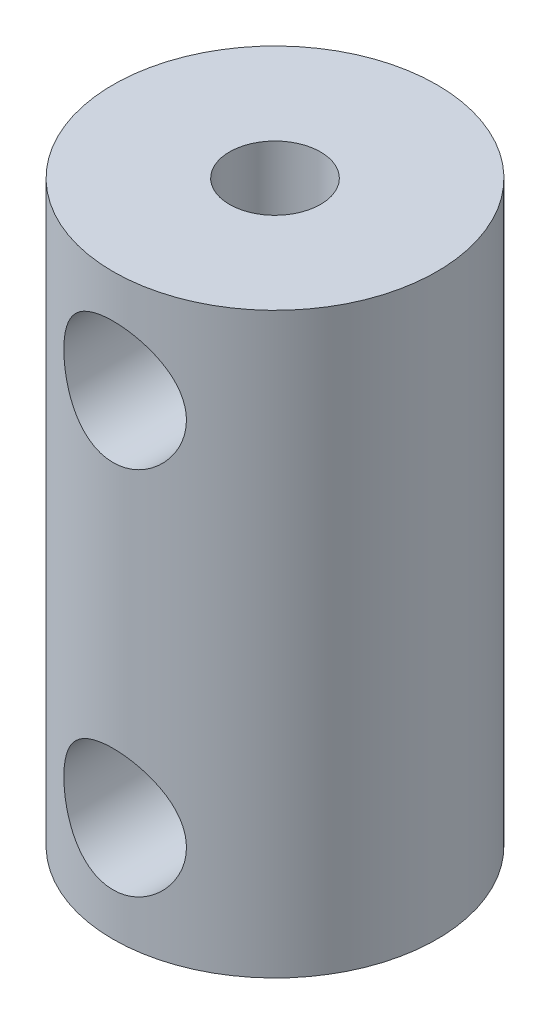
from build123d import *

# Parameters (mm, degrees)
SKETCH1_R                       = 5.334
BOSS_EXTRUDE1_DEPTH             = 19.05
F_3_0MM_DOWEL_HOLE3_D           = 3
F_3_0MM_DOWEL_HOLE3_DEPTH       = 9.525
F_3_0MM_DOWEL_HOLE3_TIP         = 0.901290929
F_3_16_0_1875_DOWEL_HOLE1_D     = 4.7625
F_3_16_0_1875_DOWEL_HOLE1_DEPTH = 9.525
F_3_16_0_1875_DOWEL_HOLE1_TIP   = 1.430799349
F_10_32_TAPPED_HOLE1_OUTLINE_R  = 2.0193
F_10_32_TAPPED_HOLE1_DEPTH      = 6


with BuildPart() as part:
    # Sketch1 → Boss-Extrude1 (new body)
    with BuildSketch(Plane(origin=(0, 0, 0), x_dir=(1, 0, 0), z_dir=(0, 1, 0))):
        with Locations(Location((0, 0, 0), (0, 0, 90))):
            Circle(SKETCH1_R)
    extrude(amount=BOSS_EXTRUDE1_DEPTH)

    # Ø3.0mm Dowel Hole3
    with Locations(Plane(origin=(0, 19.05, 0), x_dir=(1, 0, 0), z_dir=(0, 1, 0))):
        with Locations((0, 0)):
            Hole(F_3_0MM_DOWEL_HOLE3_D / 2, depth=F_3_0MM_DOWEL_HOLE3_DEPTH)
            with Locations((0, 0, -(F_3_0MM_DOWEL_HOLE3_DEPTH + F_3_0MM_DOWEL_HOLE3_TIP / 2))):  # 118° drill point
                Cone(0, F_3_0MM_DOWEL_HOLE3_D / 2, F_3_0MM_DOWEL_HOLE3_TIP, mode=Mode.SUBTRACT)

    # 3/16 (0.1875) Dowel Hole1
    with Locations(Plane(origin=(0, 0, 0), x_dir=(-1, 0, 0), z_dir=(0, -1, 0))):
        with Locations((0, 0)):
            Hole(F_3_16_0_1875_DOWEL_HOLE1_D / 2, depth=F_3_16_0_1875_DOWEL_HOLE1_DEPTH)
            with Locations((0, 0, -(F_3_16_0_1875_DOWEL_HOLE1_DEPTH + F_3_16_0_1875_DOWEL_HOLE1_TIP / 2))):  # 118° drill point
                Cone(0, F_3_16_0_1875_DOWEL_HOLE1_D / 2, F_3_16_0_1875_DOWEL_HOLE1_TIP, mode=Mode.SUBTRACT)

    # #10-32 Tapped Hole1: read off the stored shape, not the designer's step
    # #10-32 Tapped Hole1 outline → #10-32 Tapped Hole1 (cut)
    with BuildSketch(Plane.XY):
        with Locations((0, 3.429)):
            Circle(F_10_32_TAPPED_HOLE1_OUTLINE_R)
        with Locations((0, 15.621)):
            Circle(F_10_32_TAPPED_HOLE1_OUTLINE_R)
    extrude(amount=F_10_32_TAPPED_HOLE1_DEPTH, mode=Mode.SUBTRACT)


solid = part.part
